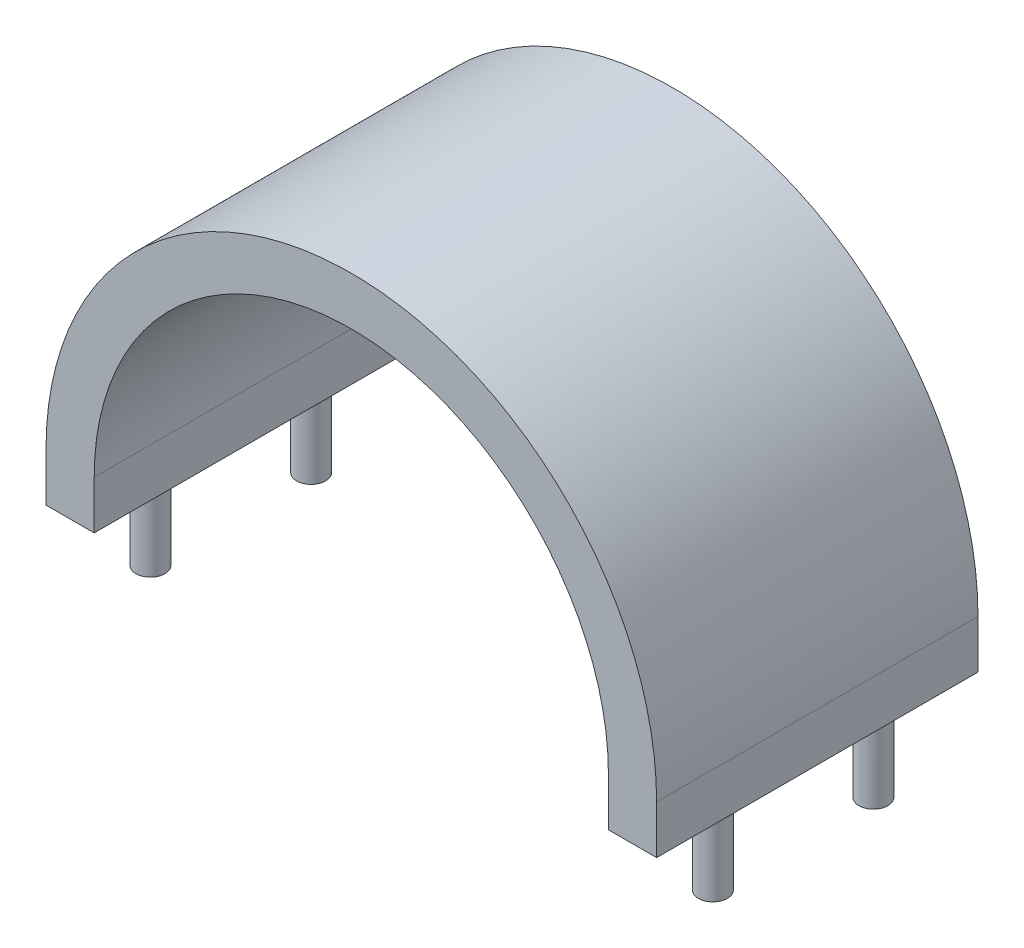
from build123d import *

# Parameters (mm, degrees)
EXTRUDE_1_DEPTH = 40
SKETCH_3_R      = 1.8
EXTRUDE_2_DEPTH = 10


with BuildPart() as part:
    # 草图1 → 凸台-拉伸1 (new body)
    with BuildSketch(Plane.XY):
        with BuildLine():
            Line((-38, 14), (-38, 20))
            ThreePointArc((-38, 20), (0, 58), (38, 20))
            Line((38, 20), (38, 14))
            Line((38, 14), (32, 14))
            Line((32, 14), (32, 20))
            ThreePointArc((32, 20), (0, 52), (-32, 20))
            Line((-32, 20), (-32, 14))
            Line((-32, 14), (-38, 14))
        make_face()
    extrude(amount=EXTRUDE_1_DEPTH)

    # 草图3 → 凸台-拉伸2 (add)
    with BuildSketch(Plane.XZ.offset(-14)):
        with Locations((-35, 30)):
            Circle(SKETCH_3_R)
        with Locations((-35, 10)):
            Circle(SKETCH_3_R)
        with Locations((35, 30)):
            Circle(SKETCH_3_R)
        with Locations((35, 10.018837564)):
            Circle(SKETCH_3_R)
    extrude(amount=EXTRUDE_2_DEPTH)


solid = part.part
